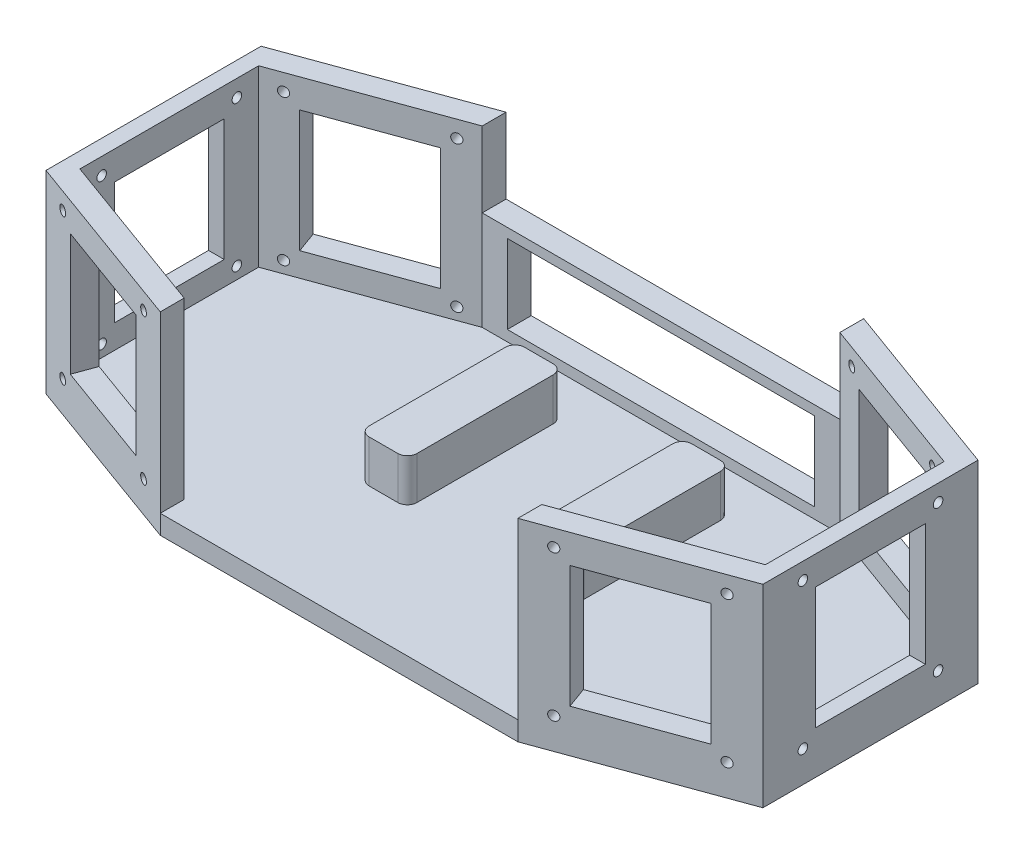
from build123d import *

# Parameters (mm, degrees)
BOSS_EXTRUDE1_DEPTH     = 8
SKETCH2_W               = 10.5
SKETCH2_H               = 10
BOSS_EXTRUDE2_DEPTH     = 37.5
SKETCH4_W               = 128.649180674
SKETCH4_H               = 10
BOSS_EXTRUDE4_DEPTH     = 4.5
BOSS_EXTRUDE5_DEPTH     = 10
SKETCH6_W               = 149.649180674
SKETCH6_H               = 10
BOSS_EXTRUDE6_DEPTH     = 4
CUT_EXTRUDE1_REACH      = 249.54
SKETCH7_R               = 2
MIRROR2_COPY_1_REACH    = 249.54
MIRROR2_COPY_1_SKETCH_R = 2
CUT_EXTRUDE2_REACH      = 314.548
SKETCH8_R               = 2
BOSS_EXTRUDE8_DEPTH     = 63
CUT_EXTRUDE3_REACH      = 257.708
SKETCH10_R              = 2
MIRROR5_COPY_1_REACH    = 257.708
MIRROR5_COPY_1_SKETCH_R = 2
CUT_EXTRUDE4_REACH      = 321.057
SKETCH11_R              = 2
SKETCH12_W              = 6.577848346
SKETCH12_H              = 46
BOSS_EXTRUDE9_DEPTH     = 12
BOSS_EXTRUDE10_DEPTH    = 17.79


with BuildPart() as part:
    # Sketch1 → Boss-Extrude1 (new body)
    with BuildSketch(Plane(origin=(0, 0, 0), x_dir=(1, 0, 0), z_dir=(0, 1, 0))):
        Polygon((-150, 45), (-150, -45), (-74.824590337, -72.361611466), (74.824590337, -72.361611466), (150, -45), (150, 45), (74.824590337, 72.361611466), (-74.824590337, 72.361611466), align=None)
    extrude(amount=BOSS_EXTRUDE1_DEPTH)

    # Sketch2 → Boss-Extrude2 (add)
    with BuildSketch(Plane(origin=(0, 8, 0), x_dir=(1, 0, 0), z_dir=(0, 1, 0))):
        with Locations((69.574590337, 67.361611466)):
            Rectangle(SKETCH2_W, SKETCH2_H)
        with Locations((-69.574590337, 67.361611466)):
            Rectangle(SKETCH2_W, SKETCH2_H)
    extrude(amount=BOSS_EXTRUDE2_DEPTH)

    # Sketch4 → Boss-Extrude4 (add)
    with BuildSketch(Plane(origin=(0, 8, 0), x_dir=(1, 0, 0), z_dir=(0, 1, 0))):
        with Locations((0, 67.361611466)):
            Rectangle(SKETCH4_W, SKETCH4_H)
    extrude(amount=BOSS_EXTRUDE4_DEPTH)

    # Sketch5 → Boss-Extrude5 (add)
    with BuildSketch(Plane(origin=(0, 8, 0), x_dir=(1, 0, 0), z_dir=(0, 1, 0))):
        Polygon((-74.824590337, 62.361611466), (-87.040594407, 57.915349603), (-140.603073792, 38.420201433), (-143.422151654, 37.394141003), (-143.422151654, -37.394141003), (-140.603073792, -38.420201433), (-87.040594407, -57.915349603), (-74.824590337, -62.361611466), (-74.824590337, -72.361611466), (-150, -45), (-150, 45), (-74.824590337, 72.361611466), align=None)
        Polygon((150, 45), (150, -45), (74.824590337, -72.361611466), (74.824590337, -62.361611466), (87.040594407, -57.915349603), (140.603073792, -38.420201433), (143.422151654, -37.394141003), (143.422151654, 37.394141003), (140.603073792, 38.420201433), (87.040594407, 57.915349603), (74.824590337, 62.361611466), (74.824590337, 72.361611466), align=None)
    extrude(amount=BOSS_EXTRUDE5_DEPTH)

    # Sketch6 → Boss-Extrude6 (add)
    with BuildSketch(Plane(origin=(0, 45.5, 0), x_dir=(1, 0, 0), z_dir=(0, 1, 0))):
        with Locations((0, 67.361611466)):
            Rectangle(SKETCH6_W, SKETCH6_H)
    extrude(amount=BOSS_EXTRUDE6_DEPTH)

    # Sketch7 → Cut-Extrude1 (cut, up to next)
    with BuildSketch(Plane(origin=(32.009387984, 0, -87.945070697), x_dir=(-0.9396926207859068, 0, -0.3420201433256732), z_dir=(0.3420201433256732, 0, -0.9396926207859068)), mode=Mode.PRIVATE) as cut_extrude1_sk1:
        with Locations((-113.852986668, 13)):
            Circle(SKETCH7_R)
    cut_extrude1_tool1 = extrude(cut_extrude1_sk1.sketch, amount=-CUT_EXTRUDE1_REACH, mode=Mode.PRIVATE) & part.part
    # Sketch7 → Cut-Extrude1 (cut, up to next)
    with BuildSketch(Plane(origin=(32.009387984, 0, -87.945070697), x_dir=(-0.9396926207859068, 0, -0.3420201433256732), z_dir=(0.3420201433256732, 0, -0.9396926207859068)), mode=Mode.PRIVATE) as cut_extrude1_sk2:
        with Locations((-57.272986668, 13)):
            Circle(SKETCH7_R)
    cut_extrude1_tool2 = extrude(cut_extrude1_sk2.sketch, amount=-CUT_EXTRUDE1_REACH, mode=Mode.PRIVATE) & part.part
    cut_extrude1_1 = cut_extrude1_tool1.solids().sort_by_distance((138.996199, 13, -49.005056))[0]
    add(cut_extrude1_1, mode=Mode.SUBTRACT)
    cut_extrude1_2 = cut_extrude1_tool2.solids().sort_by_distance((85.828391, 13, -68.356556))[0]
    add(cut_extrude1_2, mode=Mode.SUBTRACT)
    cut_extrude1 = cut_extrude1_1 + cut_extrude1_2  # Cut-Extrude1 as one shape, for the pattern or mirror that repeats it

    # Mirror1: Cut-Extrude1 across plane
    add(cut_extrude1.mirror(Plane(origin=(0, 0, 0), x_dir=(0, 0, 1), z_dir=(1, 0, 0))), mode=Mode.SUBTRACT)

    # Mirror2: Cut-Extrude1 across plane
    add(cut_extrude1.mirror(Plane(origin=(0, 0, 0), x_dir=(1, 0, 0), z_dir=(0, 0, -1))), mode=Mode.SUBTRACT)

    # Mirror2 copy 1 sketch → Mirror2 copy 1 (cut, up to next)
    with BuildSketch(Plane(origin=(-32.009387984, 0, 87.945070697), x_dir=(0.9396926207859068, 0, 0.3420201433256732), z_dir=(-0.3420201433256732, 0, 0.9396926207859068)), mode=Mode.PRIVATE) as mirror2_copy_1_sk1:
        with Locations((-113.852986668, 13)):
            Circle(MIRROR2_COPY_1_SKETCH_R)
    mirror2_copy_1_tool1 = extrude(mirror2_copy_1_sk1.sketch, amount=-MIRROR2_COPY_1_REACH, mode=Mode.PRIVATE) & part.part
    # Mirror2 copy 1 sketch → Mirror2 copy 1 (cut, up to next)
    with BuildSketch(Plane(origin=(-32.009387984, 0, 87.945070697), x_dir=(0.9396926207859068, 0, 0.3420201433256732), z_dir=(-0.3420201433256732, 0, 0.9396926207859068)), mode=Mode.PRIVATE) as mirror2_copy_1_sk2:
        with Locations((-57.272986668, 13)):
            Circle(MIRROR2_COPY_1_SKETCH_R)
    mirror2_copy_1_tool2 = extrude(mirror2_copy_1_sk2.sketch, amount=-MIRROR2_COPY_1_REACH, mode=Mode.PRIVATE) & part.part
    add(mirror2_copy_1_tool1.solids().sort_by_distance((-138.996199, 13, 49.005056))[0], mode=Mode.SUBTRACT)
    add(mirror2_copy_1_tool2.solids().sort_by_distance((-85.828391, 13, 68.356556))[0], mode=Mode.SUBTRACT)

    # Sketch8 → Cut-Extrude2 (cut, up to next)
    with BuildSketch(Plane(origin=(150, 0, 0), x_dir=(0, 0, -1), z_dir=(1, 0, 0)), mode=Mode.PRIVATE) as cut_extrude2_sk1:
        with Locations((-28.29, 13)):
            Circle(SKETCH8_R)
    cut_extrude2_tool1 = extrude(cut_extrude2_sk1.sketch, amount=-CUT_EXTRUDE2_REACH, mode=Mode.PRIVATE) & part.part
    # Sketch8 → Cut-Extrude2 (cut, up to next)
    with BuildSketch(Plane(origin=(150, 0, 0), x_dir=(0, 0, -1), z_dir=(1, 0, 0)), mode=Mode.PRIVATE) as cut_extrude2_sk2:
        with Locations((28.29, 13)):
            Circle(SKETCH8_R)
    cut_extrude2_tool2 = extrude(cut_extrude2_sk2.sketch, amount=-CUT_EXTRUDE2_REACH, mode=Mode.PRIVATE) & part.part
    cut_extrude2_1 = cut_extrude2_tool1.solids().sort_by_distance((150, 13, 28.29))[0]
    add(cut_extrude2_1, mode=Mode.SUBTRACT)
    cut_extrude2_2 = cut_extrude2_tool2.solids().sort_by_distance((150, 13, -28.29))[0]
    add(cut_extrude2_2, mode=Mode.SUBTRACT)
    cut_extrude2 = cut_extrude2_1 + cut_extrude2_2  # Cut-Extrude2 as one shape, for the pattern or mirror that repeats it

    # Mirror3: Cut-Extrude2 across plane
    add(cut_extrude2.mirror(Plane(origin=(0, 0, 0), x_dir=(0, 0, 1), z_dir=(1, 0, 0))), mode=Mode.SUBTRACT)

    # Sketch9 → Boss-Extrude8 (add)
    with BuildSketch(Plane(origin=(0, 18, 0), x_dir=(1, 0, 0), z_dir=(0, 1, 0))):
        Polygon((143.422151654, 23), (150, 23), (150, 45), (134.025225447, 50.814342437), (130.811287398, 41.984120221), (143.422151654, 37.394141003), align=None)
        Polygon((74.824590337, 72.361611466), (90.79936489, 66.54726903), (87.585426842, 57.717046814), (74.824590337, 62.361611466), align=None)
        Polygon((-74.824590337, 62.361611466), (-74.824590337, 72.361611466), (-90.79936489, 66.54726903), (-87.585426842, 57.717046814), align=None)
        Polygon((-143.422151654, 37.394141003), (-143.422151654, 23), (-150, 23), (-150, 45), (-134.025225447, 50.814342437), (-130.811287398, 41.984120221), align=None)
        Polygon((143.422151654, -37.394141003), (143.422151654, -23), (150, -23), (150, -45), (134.025225447, -50.814342437), (130.811287398, -41.984120221), align=None)
        Polygon((-143.422151654, -23), (-150, -23), (-150, -45), (-134.025225447, -50.814342437), (-130.811287398, -41.984120221), (-143.422151654, -37.394141003), align=None)
        Polygon((-74.824590337, -72.361611466), (-90.79936489, -66.54726903), (-87.585426842, -57.717046814), (-74.824590337, -62.361611466), align=None)
        Polygon((74.824590337, -62.361611466), (74.824590337, -72.361611466), (90.79936489, -66.54726903), (87.585426842, -57.717046814), align=None)
    extrude(amount=BOSS_EXTRUDE8_DEPTH)

    # Sketch10 → Cut-Extrude3 (cut, up to next)
    with BuildSketch(Plane(origin=(32.009387984, 0, -87.945070697), x_dir=(-0.9396926207859068, 0, -0.3420201433256732), z_dir=(0.3420201433256732, 0, -0.9396926207859068)), mode=Mode.PRIVATE) as cut_extrude3_sk1:
        with Locations((-113.852986668, 74)):
            Circle(SKETCH10_R)
    cut_extrude3_tool1 = extrude(cut_extrude3_sk1.sketch, amount=-CUT_EXTRUDE3_REACH, mode=Mode.PRIVATE) & part.part
    # Sketch10 → Cut-Extrude3 (cut, up to next)
    with BuildSketch(Plane(origin=(32.009387984, 0, -87.945070697), x_dir=(-0.9396926207859068, 0, -0.3420201433256732), z_dir=(0.3420201433256732, 0, -0.9396926207859068)), mode=Mode.PRIVATE) as cut_extrude3_sk2:
        with Locations((-57.272986668, 74)):
            Circle(SKETCH10_R)
    cut_extrude3_tool2 = extrude(cut_extrude3_sk2.sketch, amount=-CUT_EXTRUDE3_REACH, mode=Mode.PRIVATE) & part.part
    cut_extrude3_1 = cut_extrude3_tool1.solids().sort_by_distance((138.996199, 74, -49.005056))[0]
    add(cut_extrude3_1, mode=Mode.SUBTRACT)
    cut_extrude3_2 = cut_extrude3_tool2.solids().sort_by_distance((85.828391, 74, -68.356556))[0]
    add(cut_extrude3_2, mode=Mode.SUBTRACT)
    cut_extrude3 = cut_extrude3_1 + cut_extrude3_2  # Cut-Extrude3 as one shape, for the pattern or mirror that repeats it

    # Mirror4: Cut-Extrude3 across plane
    add(cut_extrude3.mirror(Plane(origin=(0, 0, 0), x_dir=(0, 0, 1), z_dir=(1, 0, 0))), mode=Mode.SUBTRACT)

    # Mirror5: Cut-Extrude3 across plane
    add(cut_extrude3.mirror(Plane(origin=(0, 0, 0), x_dir=(1, 0, 0), z_dir=(0, 0, -1))), mode=Mode.SUBTRACT)

    # Mirror5 copy 1 sketch → Mirror5 copy 1 (cut, up to next)
    with BuildSketch(Plane(origin=(-32.009387984, 0, 87.945070697), x_dir=(0.9396926207859068, 0, 0.3420201433256732), z_dir=(-0.3420201433256732, 0, 0.9396926207859068)), mode=Mode.PRIVATE) as mirror5_copy_1_sk1:
        with Locations((-113.852986668, 74)):
            Circle(MIRROR5_COPY_1_SKETCH_R)
    mirror5_copy_1_tool1 = extrude(mirror5_copy_1_sk1.sketch, amount=-MIRROR5_COPY_1_REACH, mode=Mode.PRIVATE) & part.part
    # Mirror5 copy 1 sketch → Mirror5 copy 1 (cut, up to next)
    with BuildSketch(Plane(origin=(-32.009387984, 0, 87.945070697), x_dir=(0.9396926207859068, 0, 0.3420201433256732), z_dir=(-0.3420201433256732, 0, 0.9396926207859068)), mode=Mode.PRIVATE) as mirror5_copy_1_sk2:
        with Locations((-57.272986668, 74)):
            Circle(MIRROR5_COPY_1_SKETCH_R)
    mirror5_copy_1_tool2 = extrude(mirror5_copy_1_sk2.sketch, amount=-MIRROR5_COPY_1_REACH, mode=Mode.PRIVATE) & part.part
    add(mirror5_copy_1_tool1.solids().sort_by_distance((-138.996199, 74, 49.005056))[0], mode=Mode.SUBTRACT)
    add(mirror5_copy_1_tool2.solids().sort_by_distance((-85.828391, 74, 68.356556))[0], mode=Mode.SUBTRACT)

    # Sketch11 → Cut-Extrude4 (cut, up to next)
    with BuildSketch(Plane(origin=(150, 0, 0), x_dir=(0, 0, -1), z_dir=(1, 0, 0)), mode=Mode.PRIVATE) as cut_extrude4_sk1:
        with Locations((-28.29, 74)):
            Circle(SKETCH11_R)
    cut_extrude4_tool1 = extrude(cut_extrude4_sk1.sketch, amount=-CUT_EXTRUDE4_REACH, mode=Mode.PRIVATE) & part.part
    # Sketch11 → Cut-Extrude4 (cut, up to next)
    with BuildSketch(Plane(origin=(150, 0, 0), x_dir=(0, 0, -1), z_dir=(1, 0, 0)), mode=Mode.PRIVATE) as cut_extrude4_sk2:
        with Locations((28.29, 74)):
            Circle(SKETCH11_R)
    cut_extrude4_tool2 = extrude(cut_extrude4_sk2.sketch, amount=-CUT_EXTRUDE4_REACH, mode=Mode.PRIVATE) & part.part
    cut_extrude4_1 = cut_extrude4_tool1.solids().sort_by_distance((150, 74, 28.29))[0]
    add(cut_extrude4_1, mode=Mode.SUBTRACT)
    cut_extrude4_2 = cut_extrude4_tool2.solids().sort_by_distance((150, 74, -28.29))[0]
    add(cut_extrude4_2, mode=Mode.SUBTRACT)
    cut_extrude4 = cut_extrude4_1 + cut_extrude4_2  # Cut-Extrude4 as one shape, for the pattern or mirror that repeats it

    # Mirror6: Cut-Extrude4 across plane
    add(cut_extrude4.mirror(Plane(origin=(0, 0, 0), x_dir=(0, 0, 1), z_dir=(1, 0, 0))), mode=Mode.SUBTRACT)

    # Sketch12 → Boss-Extrude9 (add)
    with BuildSketch(Plane(origin=(0, 81, 0), x_dir=(1, 0, 0), z_dir=(0, 1, 0))):
        Polygon((130.811287398, 41.984120221), (87.585426842, 57.717046814), (90.79936489, 66.54726903), (134.025225447, 50.814342437), align=None)
        with Locations((146.711075827, 0)):
            Rectangle(SKETCH12_W, SKETCH12_H)
        Polygon((134.025225447, -50.814342437), (130.811287398, -41.984120221), (87.585426842, -57.717046814), (90.79936489, -66.54726903), align=None)
        Polygon((-130.811287398, -41.984120221), (-87.585426842, -57.717046814), (-90.79936489, -66.54726903), (-134.025225447, -50.814342437), align=None)
        with Locations((-146.711075827, 0)):
            Rectangle(SKETCH12_W, SKETCH12_H)
        Polygon((-134.025225447, 50.814342437), (-130.811287398, 41.984120221), (-87.585426842, 57.717046814), (-90.79936489, 66.54726903), align=None)
    extrude(amount=-BOSS_EXTRUDE9_DEPTH)

    # Sketch13 → Boss-Extrude10 (add)
    with BuildSketch(Plane(origin=(0, 8, 0), x_dir=(1, 0, 0), z_dir=(0, 1, 0))):
        with BuildLine():
            Line((-41, 46.231611466), (-29, 46.231611466))
            ThreePointArc((-29, 46.231611466), (-26.171572875, 45.060038591), (-25, 42.231611466))
            Line((-25, 42.231611466), (-25, -14.768388534))
            ThreePointArc((-25, -14.768388534), (-26.171572875, -17.596815659), (-29, -18.768388534))
            Line((-29, -18.768388534), (-41, -18.768388534))
            ThreePointArc((-41, -18.768388534), (-43.828427125, -17.596815659), (-45, -14.768388534))
            Line((-45, -14.768388534), (-45, 42.231611466))
            ThreePointArc((-45, 42.231611466), (-43.828427125, 45.060038591), (-41, 46.231611466))
        make_face()
        with BuildLine():
            Line((45, 42.231611466), (45, -14.768388534))
            ThreePointArc((45, -14.768388534), (43.828427125, -17.596815659), (41, -18.768388534))
            Line((41, -18.768388534), (29, -18.768388534))
            ThreePointArc((29, -18.768388534), (26.171572875, -17.596815659), (25, -14.768388534))
            Line((25, -14.768388534), (25, 42.231611466))
            ThreePointArc((25, 42.231611466), (26.171572875, 45.060038591), (29, 46.231611466))
            Line((29, 46.231611466), (41, 46.231611466))
            ThreePointArc((41, 46.231611466), (43.828427125, 45.060038591), (45, 42.231611466))
        make_face()
    extrude(amount=BOSS_EXTRUDE10_DEPTH)


solid = part.part
